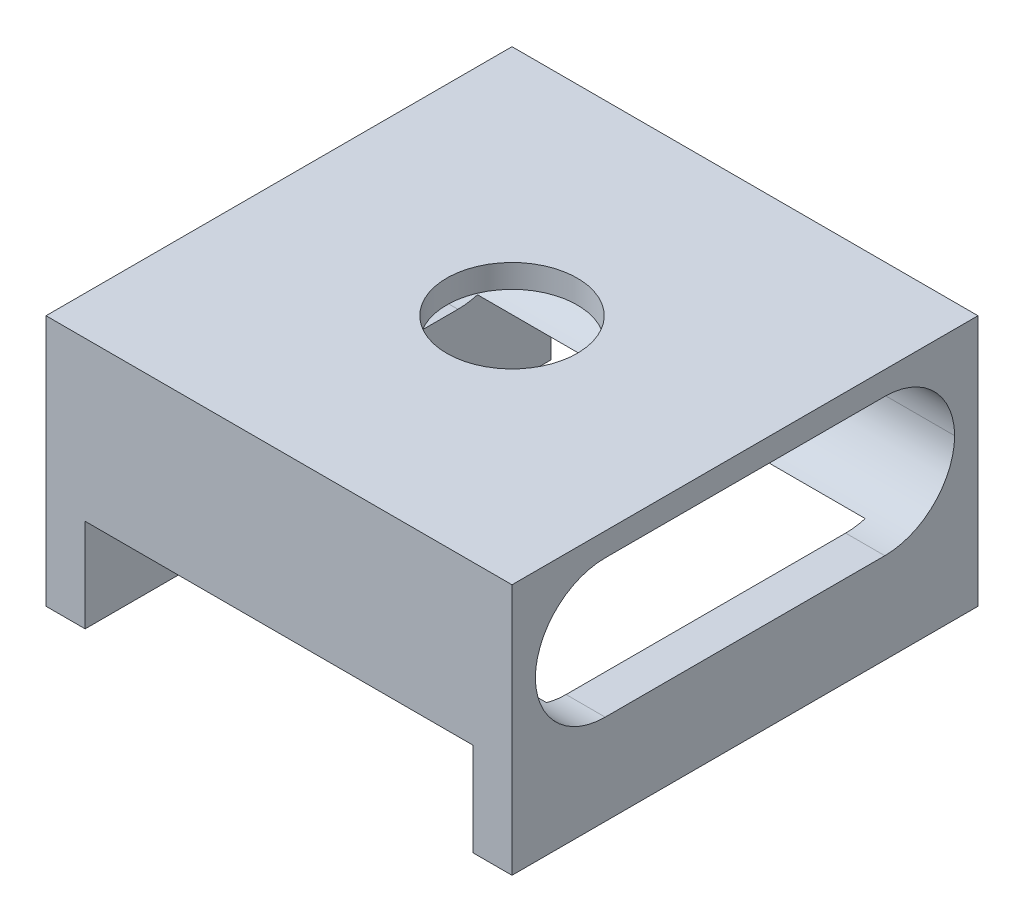
from build123d import *

# Parameters (mm, degrees)
SKETCH1_W           = 31.75
SKETCH1_H           = 31.75
BOSS_EXTRUDE1_DEPTH = 17.145
SKETCH2_R           = 4.445
CUT_EXTRUDE1_DEPTH  = 49.063250254
SKETCH3_W           = 26.416
SKETCH3_H           = 6.35
CUT_EXTRUDE2_DEPTH  = 49.063250254
SKETCH4_W           = 28.575
SKETCH4_H           = 9.398
CUT_EXTRUDE3_DEPTH  = 49.063250254
FILLET2_DEPTH       = 31.75
FILLET2_2_DEPTH     = 2.667
FILLET2_START       = 29.083
FILLET2_3_DEPTH     = 2.667


with BuildPart() as part:
    # Sketch1 → Boss-Extrude1 (new body)
    with BuildSketch(Plane(origin=(0, 0, 0), x_dir=(1, 0, 0), z_dir=(0, 1, 0))):
        with Locations((15.875, 15.875)):
            Rectangle(SKETCH1_W, SKETCH1_H)
    extrude(amount=BOSS_EXTRUDE1_DEPTH)

    # Sketch2 → Cut-Extrude1 (cut, through all)
    with BuildSketch(Plane(origin=(0, 17.145, 0), x_dir=(1, 0, 0), z_dir=(0, 1, 0))):
        with Locations(Location((15.875, 15.875, 0), (0, 0, 270))):
            Circle(SKETCH2_R)
    extrude(amount=-CUT_EXTRUDE1_DEPTH, mode=Mode.SUBTRACT)

    # Sketch3 → Cut-Extrude2 (cut, through all)
    with BuildSketch(Plane.XY):
        with Locations((15.875, 3.175)):
            Rectangle(SKETCH3_W, SKETCH3_H)
    extrude(amount=-CUT_EXTRUDE2_DEPTH, mode=Mode.SUBTRACT)

    # Sketch4 → Cut-Extrude3 (cut, through all)
    with BuildSketch(Plane.ZY):
        with Locations((-15.875, 10.8585)):
            Rectangle(SKETCH4_W, SKETCH4_H)
    extrude(amount=-CUT_EXTRUDE3_DEPTH, mode=Mode.SUBTRACT)

    # Fillet2: read off the stored shape, not the designer's step
    # Fillet2 outline → Fillet2 (add)
    with BuildSketch(Plane.YZ):
        with BuildLine():
            Line((6.35, -26.7335), (6.35, -30.1625))
            Line((6.35, -30.1625), (15.5575, -30.1625))
            Line((15.5575, -30.1625), (15.5575, -25.4))
            ThreePointArc((15.5575, -25.4), (14.184972345, -28.745070067), (10.8585, -30.162076648))
            ThreePointArc((10.8585, -30.162076648), (8.039162939, -29.190864906), (6.35, -26.7335))
        make_face()
        with BuildLine():
            ThreePointArc((10.8585, -1.587923352), (14.184972345, -3.004929933), (15.5575, -6.35))
            Line((15.5575, -6.35), (15.5575, -1.5875))
            Line((15.5575, -1.5875), (6.35, -1.5875))
            Line((6.35, -1.5875), (6.35, -5.0165))
            ThreePointArc((6.35, -5.0165), (8.039162939, -2.559135094), (10.8585, -1.587923352))
        make_face()
    extrude(amount=FILLET2_DEPTH)

    # Fillet2 2 outline → Fillet2 2 (add)
    with BuildSketch(Plane.YZ):
        with BuildLine():
            Line((6.1595, -30.1625), (6.35, -30.1625))
            Line((6.35, -30.1625), (6.35, -26.7335))
            ThreePointArc((6.35, -26.7335), (6.207365536, -26.073519209), (6.1595, -25.4))
            Line((6.1595, -25.4), (6.1595, -30.1625))
        make_face()
        with BuildLine():
            Line((6.1595, -1.5875), (6.1595, -6.35))
            ThreePointArc((6.1595, -6.35), (6.207365536, -5.676480791), (6.35, -5.0165))
            Line((6.35, -5.0165), (6.35, -1.5875))
            Line((6.35, -1.5875), (6.1595, -1.5875))
        make_face()
    extrude(amount=FILLET2_2_DEPTH)

    # Fillet2 3 outline → Fillet2 3 (add)
    with BuildSketch(Plane.YZ.offset(FILLET2_START)):
        with BuildLine():
            Line((6.1595, -30.1625), (6.35, -30.1625))
            Line((6.35, -30.1625), (6.35, -26.7335))
            ThreePointArc((6.35, -26.7335), (6.207365536, -26.073519209), (6.1595, -25.4))
            Line((6.1595, -25.4), (6.1595, -30.1625))
        make_face()
        with BuildLine():
            Line((6.1595, -1.5875), (6.1595, -6.35))
            ThreePointArc((6.1595, -6.35), (6.207365536, -5.676480791), (6.35, -5.0165))
            Line((6.35, -5.0165), (6.35, -1.5875))
            Line((6.35, -1.5875), (6.1595, -1.5875))
        make_face()
    extrude(amount=FILLET2_3_DEPTH)


solid = part.part
